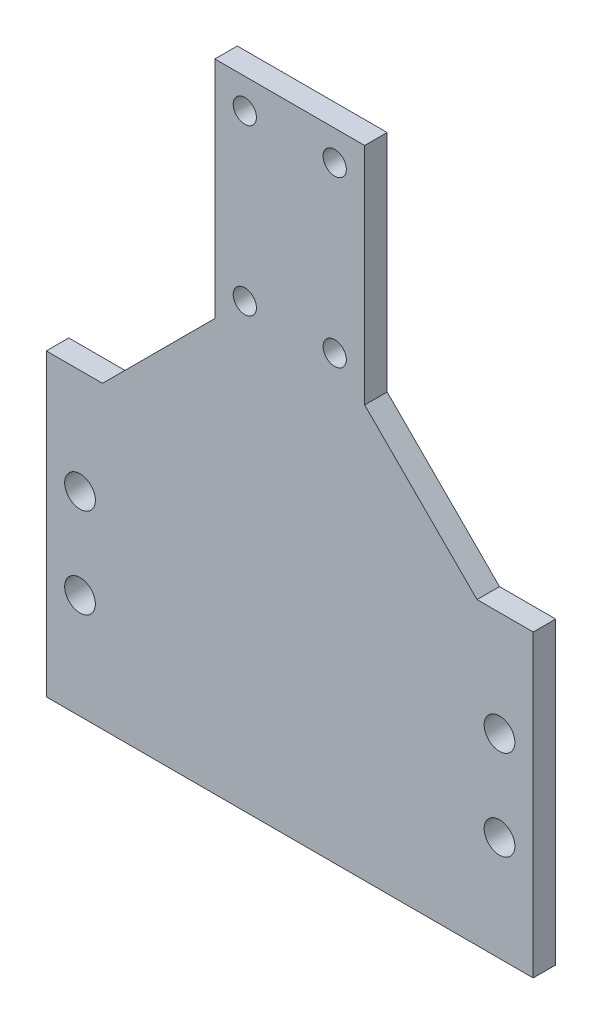
from build123d import *

# Parameters (mm, degrees)
EXTRUDE_1_DEPTH     = 3
SKETCH_2_R          = 1.55
CUT_EXTRUDE_1_DEPTH = 92.050809991
SKETCH_3_R          = 2.05
CUT_EXTRUDE_2_DEPTH = 92.050809991


with BuildPart() as part:
    # 草图1 → 凸台-拉伸1 (new body)
    with BuildSketch(Plane.XY):
        Polygon((-32.5, 40), (-25, 40), (-10, 55), (-10, 85), (10, 85), (10, 55), (25, 40), (32.5, 40), (32.5, 0), (-32.5, 0), align=None)
    extrude(amount=EXTRUDE_1_DEPTH)

    # 草图2 → 切除-拉伸1 (cut, through all)
    with BuildSketch(Plane.XY.offset(3)):
        with Locations((-6, 81)):
            Circle(SKETCH_2_R)
        with Locations((-6, 59)):
            Circle(SKETCH_2_R)
        with Locations((6, 59)):
            Circle(SKETCH_2_R)
        with Locations((6, 81)):
            Circle(SKETCH_2_R)
    extrude(amount=-CUT_EXTRUDE_1_DEPTH, mode=Mode.SUBTRACT)

    # 草图3 → 切除-拉伸2 (cut, through all)
    with BuildSketch(Plane.XY.offset(3)):
        with Locations((-28, 26)):
            Circle(SKETCH_3_R)
        with Locations((-28, 14)):
            Circle(SKETCH_3_R)
        with Locations((28, 14)):
            Circle(SKETCH_3_R)
        with Locations((28, 26)):
            Circle(SKETCH_3_R)
    extrude(amount=-CUT_EXTRUDE_2_DEPTH, mode=Mode.SUBTRACT)


solid = part.part
